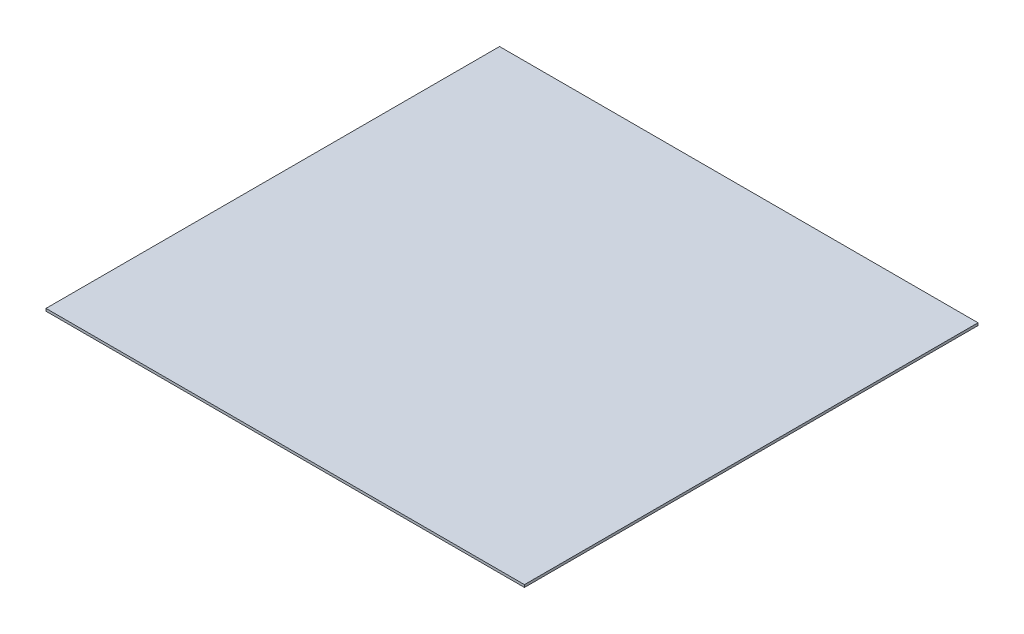
from build123d import *

# Parameters (mm, degrees)
SKETCH1_W           = 609.6
SKETCH1_H           = 577.85
BOSS_EXTRUDE1_DEPTH = 1.5875


with BuildPart() as part:
    # Sketch1 → Boss-Extrude1 (new, symmetric)
    with BuildSketch(Plane(origin=(0, 0, 0), x_dir=(1, 0, 0), z_dir=(0, 1, 0))):
        Rectangle(SKETCH1_W, SKETCH1_H)
    extrude(amount=BOSS_EXTRUDE1_DEPTH, both=True)


solid = part.part
